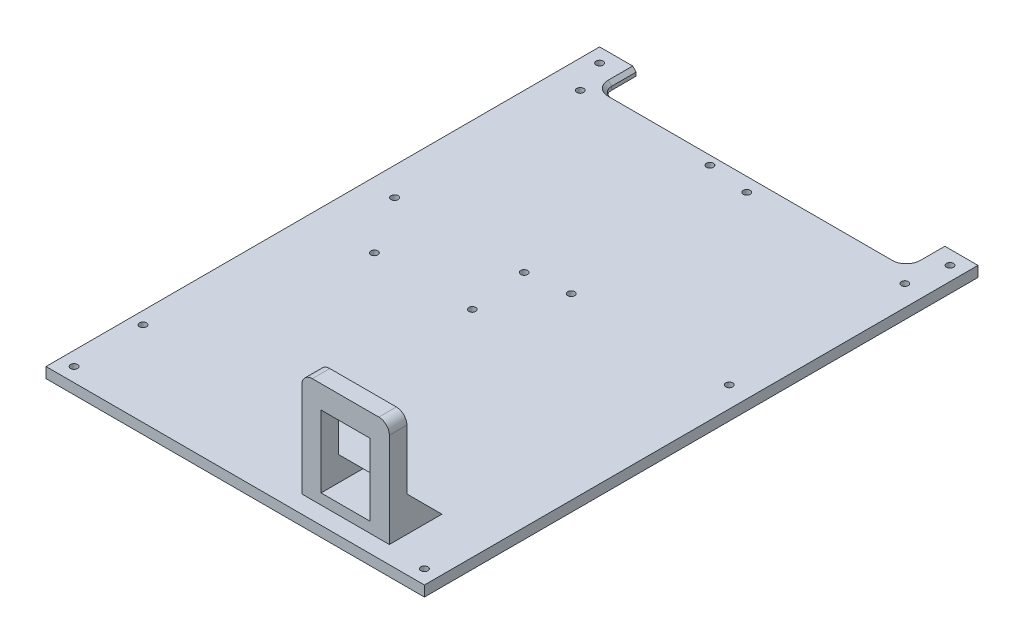
from build123d import *

# Parameters (mm, degrees)
ESBO_O1_W                = 110
ESBO_O1_H                = 160
RESSALTO_EXTRUS_O1_DEPTH = 3
ESBO_O3_W                = 110
ESBO_O3_H                = 160
ESBO_O3_W_2              = 108
ESBO_O3_H_2              = 158
ESBO_O3_R                = 1
CORTE_EXTRUS_O1_DEPTH    = 98.128780493
ESBO_O5_W                = 87.098953266
ESBO_O5_H                = 10
CORTE_EXTRUS_O2_DEPTH    = 96.739229159
ESBO_O6_W                = 25
ESBO_O6_H                = 5
RESSALTO_EXTRUS_O2_DEPTH = 30
ESBO_O7_W                = 14
ESBO_O7_H                = 20.5
CORTE_EXTRUS_O3_DEPTH    = 171.202820188
ESBO_O8_R                = 1
CORTE_EXTRUS_O4_DEPTH    = 101.284595028
CHANFRO1_SIZE            = 10
FILETE1_R                = 3
FILETE2_R                = 3
CHANFRO2_SIZE            = 1


with BuildPart() as part:
    # Esboço1 → Ressalto-extrusão1 (new body)
    with BuildSketch(Plane(origin=(0, 0, 0), x_dir=(1, 0, 0), z_dir=(0, 1, 0))):
        Rectangle(ESBO_O1_W, ESBO_O1_H)
    extrude(amount=RESSALTO_EXTRUS_O1_DEPTH)

    # Esboço3 → Corte-extrusão1 (cut, through all)
    # profile 1 of 5: a face of its own
    with BuildSketch(Plane(origin=(0, 3, 0), x_dir=(1, 0, 0), z_dir=(0, 1, 0))):
        Rectangle(ESBO_O3_W, ESBO_O3_H)
        Rectangle(ESBO_O3_W_2, ESBO_O3_H_2, mode=Mode.SUBTRACT)
    # profile 2 of 5: a face of its own
    with BuildSketch(Plane(origin=(0, 3, 0), x_dir=(1, 0, 0), z_dir=(0, 1, 0))):
        with Locations(Location((-50, -75, 0), (0, 0, 270))):
            Circle(ESBO_O3_R)
    # profile 3 of 5: a face of its own
    with BuildSketch(Plane(origin=(0, 3, 0), x_dir=(1, 0, 0), z_dir=(0, 1, 0))):
        with Locations(Location((50, -75, 0), (0, 0, 270))):
            Circle(ESBO_O3_R)
    # profile 4 of 5: a face of its own
    with BuildSketch(Plane(origin=(0, 3, 0), x_dir=(1, 0, 0), z_dir=(0, 1, 0))):
        with Locations(Location((50, 75, 0), (0, 0, 270))):
            Circle(ESBO_O3_R)
    # profile 5 of 5: a face of its own
    with BuildSketch(Plane(origin=(0, 3, 0), x_dir=(1, 0, 0), z_dir=(0, 1, 0))):
        with Locations(Location((-50, 75, 0), (0, 0, 270))):
            Circle(ESBO_O3_R)
    extrude(amount=-CORTE_EXTRUS_O1_DEPTH, mode=Mode.SUBTRACT)

    # Esboço5 → Corte-extrusão2 (cut, through all)
    with BuildSketch(Plane(origin=(0, 3, 0), x_dir=(1, 0, 0), z_dir=(0, 1, 0))):
        with Locations((0, 74)):
            Rectangle(ESBO_O5_W, ESBO_O5_H)
    extrude(amount=-CORTE_EXTRUS_O2_DEPTH, mode=Mode.SUBTRACT)

    # Esboço6 → Ressalto-extrusão2 (add)
    with BuildSketch(Plane(origin=(0, 3, 0), x_dir=(1, 0, 0), z_dir=(0, 1, 0))):
        with Locations((26.5, -71.5)):
            Rectangle(ESBO_O6_W, ESBO_O6_H)
    extrude(amount=RESSALTO_EXTRUS_O2_DEPTH)

    # Esboço7 → Corte-extrusão3 (cut, through all)
    with BuildSketch(Plane.XY.offset(79)):
        with Locations((26.5, 16.25)):
            Rectangle(ESBO_O7_W, ESBO_O7_H)
    extrude(amount=-CORTE_EXTRUS_O3_DEPTH, mode=Mode.SUBTRACT)

    # Esboço8 → Corte-extrusão4 (cut, through all)
    with BuildSketch(Plane(origin=(0, 3, 0), x_dir=(1, 0, 0), z_dir=(0, 1, 0))):
        with Locations(Location((-50.46, -54.857726713, 0), (0, 0, 270))):
            Circle(ESBO_O8_R)
        with Locations(Location((-2.2, -56.127726713, 0), (0, 0, 270))):
            Circle(ESBO_O8_R)
        with Locations(Location((-7.28, -4.057726713, 0), (0, 0, 270))):
            Circle(ESBO_O8_R)
        with Locations(Location((-35.22, -4.057726713, 0), (0, 0, 270))):
            Circle(ESBO_O8_R)
        with Locations(Location((48.05, 13.95, 0), (0, 0, 270))):
            Circle(ESBO_O8_R)
        with Locations(Location((2.95, 13.95, 0), (0, 0, 270))):
            Circle(ESBO_O8_R)
        with Locations(Location((-9, 12.482273287, 0), (0, 0, 270))):
            Circle(ESBO_O8_R)
        with Locations(Location((-46, 12.482273287, 0), (0, 0, 270))):
            Circle(ESBO_O8_R)
        with Locations(Location((48.05, 64.05, 0), (0, 0, 270))):
            Circle(ESBO_O8_R)
        with Locations(Location((2.95, 64.05, 0), (0, 0, 270))):
            Circle(ESBO_O8_R)
        with Locations(Location((-9, 65.482273287, 0), (0, 0, 270))):
            Circle(ESBO_O8_R)
        with Locations(Location((-46, 65.482273287, 0), (0, 0, 270))):
            Circle(ESBO_O8_R)
    extrude(amount=-CORTE_EXTRUS_O4_DEPTH, mode=Mode.SUBTRACT)

    # Chanfro1
    # the kernel refuses this chamfer: 10 mm, written as the material it adds along each edge
    with BuildSketch(Plane(origin=(14, 3, 69), x_dir=(0, -0.02749587661058636, -0.9996219169112968), z_dir=(1, 0, 0))) as chanfro1_piece_1_section:
        Polygon((CHANFRO1_SIZE * 0.999621916911, CHANFRO1_SIZE * 0.0274958766106), (-CHANFRO1_SIZE * 0.0274958766106, CHANFRO1_SIZE * 0.999621916911), (0, 0), align=None)
    chanfro1_piece_1 = extrude(amount=25, mode=Mode.PRIVATE)
    chanfro1_piece_1 = split(chanfro1_piece_1, bisect_by=Plane(origin=(16.75, 6, 64.635027274), z_dir=(0, -1, 0)), keep=Keep.TOP, mode=Mode.PRIVATE)
    chanfro1_piece_1 = split(chanfro1_piece_1, bisect_by=Plane(origin=(19.5, 4.275363385, 64.635027274), z_dir=(-1, 0, 0)), keep=Keep.TOP, mode=Mode.PRIVATE)
    add(chanfro1_piece_1)
    with BuildSketch(Plane(origin=(14, 3, 69), x_dir=(0, -0.02749587661058636, -0.9996219169112968), z_dir=(1, 0, 0))) as chanfro1_piece_2_section:
        Polygon((CHANFRO1_SIZE * 0.999621916911, CHANFRO1_SIZE * 0.0274958766106), (-CHANFRO1_SIZE * 0.0274958766106, CHANFRO1_SIZE * 0.999621916911), (0, 0), align=None)
    chanfro1_piece_2 = extrude(amount=25, mode=Mode.PRIVATE)
    chanfro1_piece_2 = split(chanfro1_piece_2, bisect_by=Plane(origin=(16.75, 6, 66.852482787), z_dir=(0, 1, 0)), keep=Keep.TOP, mode=Mode.PRIVATE)
    chanfro1_piece_2 = split(chanfro1_piece_2, bisect_by=Plane(origin=(19.5, 8.478561277, 66.852482787), z_dir=(-1, 0, 0)), keep=Keep.TOP, mode=Mode.PRIVATE)
    add(chanfro1_piece_2)
    with BuildSketch(Plane(origin=(14, 3, 69), x_dir=(0, -0.02749587661058636, -0.9996219169112968), z_dir=(1, 0, 0))) as chanfro1_piece_3_section:
        Polygon((CHANFRO1_SIZE * 0.999621916911, CHANFRO1_SIZE * 0.0274958766106), (-CHANFRO1_SIZE * 0.0274958766106, CHANFRO1_SIZE * 0.999621916911), (0, 0), align=None)
    chanfro1_piece_3 = extrude(amount=25, mode=Mode.PRIVATE)
    chanfro1_piece_3 = split(chanfro1_piece_3, bisect_by=Plane(origin=(33.5, 4.275363385, 64.635027274), z_dir=(-1, 0, 0)), keep=Keep.TOP, mode=Mode.PRIVATE)
    chanfro1_piece_3 = split(chanfro1_piece_3, bisect_by=Plane(origin=(26.5, 6, 64.635027274), z_dir=(0, -1, 0)), keep=Keep.TOP, mode=Mode.PRIVATE)
    chanfro1_piece_3 = split(chanfro1_piece_3, bisect_by=Plane(origin=(19.5, 4.275363385, 64.635027274), z_dir=(1, 0, 0)), keep=Keep.TOP, mode=Mode.PRIVATE)
    add(chanfro1_piece_3)
    with BuildSketch(Plane(origin=(14, 3, 69), x_dir=(0, -0.02749587661058636, -0.9996219169112968), z_dir=(1, 0, 0))) as chanfro1_piece_4_section:
        Polygon((CHANFRO1_SIZE * 0.999621916911, CHANFRO1_SIZE * 0.0274958766106), (-CHANFRO1_SIZE * 0.0274958766106, CHANFRO1_SIZE * 0.999621916911), (0, 0), align=None)
    chanfro1_piece_4 = extrude(amount=25, mode=Mode.PRIVATE)
    chanfro1_piece_4 = split(chanfro1_piece_4, bisect_by=Plane(origin=(33.5, 4.275363385, 64.635027274), z_dir=(1, 0, 0)), keep=Keep.TOP, mode=Mode.PRIVATE)
    chanfro1_piece_4 = split(chanfro1_piece_4, bisect_by=Plane(origin=(36.25, 6, 64.635027274), z_dir=(0, -1, 0)), keep=Keep.TOP, mode=Mode.PRIVATE)
    add(chanfro1_piece_4)
    with BuildSketch(Plane(origin=(14, 3, 69), x_dir=(0, -0.02749587661058636, -0.9996219169112968), z_dir=(1, 0, 0))) as chanfro1_piece_5_section:
        Polygon((CHANFRO1_SIZE * 0.999621916911, CHANFRO1_SIZE * 0.0274958766106), (-CHANFRO1_SIZE * 0.0274958766106, CHANFRO1_SIZE * 0.999621916911), (0, 0), align=None)
    chanfro1_piece_5 = extrude(amount=25, mode=Mode.PRIVATE)
    chanfro1_piece_5 = split(chanfro1_piece_5, bisect_by=Plane(origin=(33.5, 8.478561277, 66.852482787), z_dir=(1, 0, 0)), keep=Keep.TOP, mode=Mode.PRIVATE)
    chanfro1_piece_5 = split(chanfro1_piece_5, bisect_by=Plane(origin=(36.25, 6, 66.852482787), z_dir=(0, 1, 0)), keep=Keep.TOP, mode=Mode.PRIVATE)
    add(chanfro1_piece_5)

    # Filete1
    filete1_edges = [part.edges().sort_by_distance(p)[0] for p in [
        (39, 33, 71.5),
        (14, 33, 71.5),
    ]]
    fillet(filete1_edges, radius=FILETE1_R)

    # Filete2
    filete2_edges = [part.edges().sort_by_distance(p)[0] for p in [
        (-43.549476633, 1.5, -69),
        (43.549476633, 1.5, -69),
    ]]
    fillet(filete2_edges, radius=FILETE2_R)

    # Chanfro2
    chanfro2_edges = [part.edges().sort_by_distance(p)[0] for p in [
        (43.549476633, 3, -75.5),
        (43.549476633, 0, -75.5),
        (0, 3, -69),
        (0, 0, -69),
        (42.670796977, 3, -69.878679656),
        (42.670796977, 0, -69.878679656),
        (-42.670796977, 3, -69.878679656),
        (-42.670796977, 0, -69.878679656),
        (-43.549476633, 0, -75.5),
        (-43.549476633, 3, -75.5),
    ]]
    chamfer(chanfro2_edges, length=CHANFRO2_SIZE)


solid = part.part
